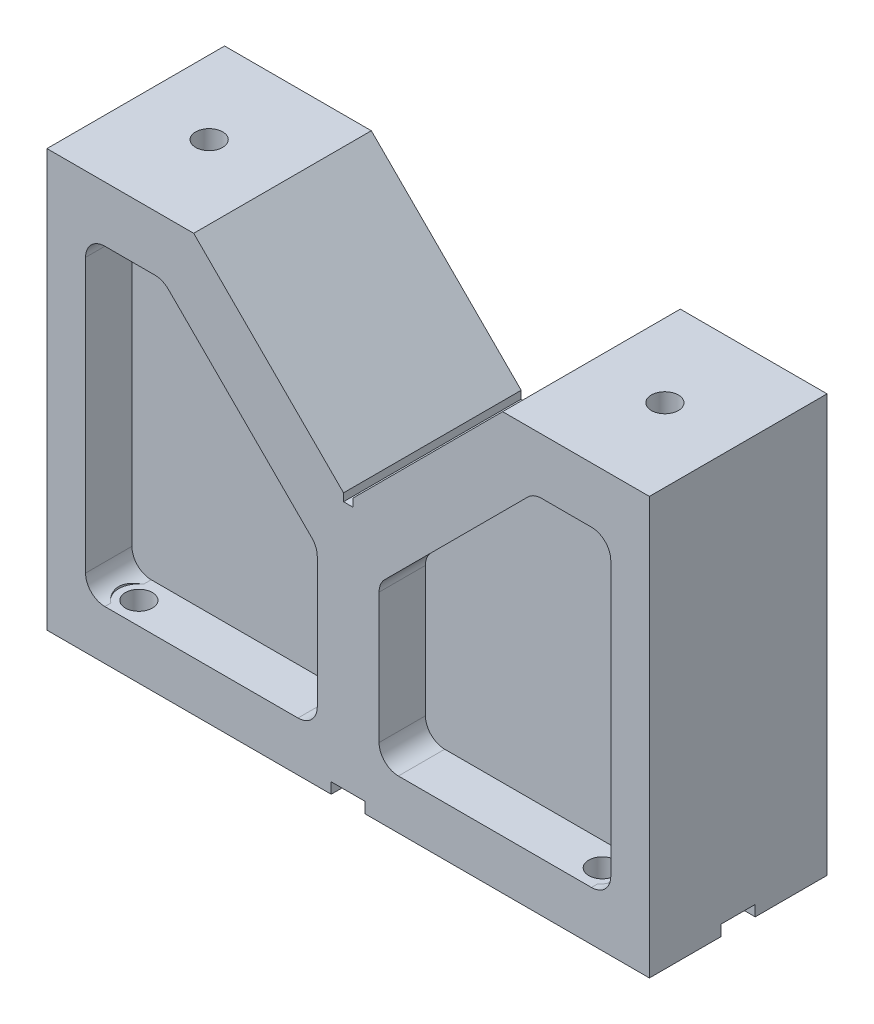
from build123d import *

# Parameters (mm, degrees)
BOSS_EXTRUDE1_DEPTH                            = 57.5
CUT_EXTRUDE1_DEPTH                             = 30
M20_TAPPED_HOLE1_D                             = 17.5
M20_TAPPED_HOLE1_DEPTH                         = 44.5
M20_TAPPED_HOLE1_TIP                           = 5.257530416491153
MIRROR2_COPY_1_DEPTH                           = 30
CUT_EXTRUDE2_DEPTH                             = 7
CUT_EXTRUDE3_DEPTH                             = 7
CBORE_START                                    = -1
CBORE_FOR_M16_HEX_SOCKET_HEAD_CAP_SC_2_R       = 8.75
CBORE_FOR_M16_HEX_SOCKET_HEAD_CAP_SCREW1_DEPTH = 34.275018433
CBORE_START_2                                  = 32
CBORE_FOR_M16_HEX_SOCKET_HEAD_CAP_SC_3_O_R     = 8.75
CBORE_FOR_M16_HEX_SOCKET_HEAD_CAP_SC_3_DEPTH   = 12.5


with BuildPart() as part:
    # Sketch1 → Boss-Extrude1 (new, symmetric)
    with BuildSketch(Plane.XY):
        Polygon((-195, 0), (195, 0), (195.00000000000003, 270), (99.9999999999997, 270.00000000000006), (2.999999999999999, 173.00000000000009), (2.999999999999999, 168.0000000000001), (-2.999999999999999, 168.0000000000001), (-2.999999999999999, 173.00000000000009), (-99.9999999999997, 270.00000000000006), (-195.00000000000003, 270), align=None)
    extrude(amount=BOSS_EXTRUDE1_DEPTH, both=True)

    # Sketch2 → Cut-Extrude1 (cut)
    with BuildSketch(Plane.XY.offset(57.5)):
        with BuildLine():
            Line((32.500000000000014, 32), (157.5, 32))
            ThreePointArc((157.5, 32), (166.33883476483186, 35.661165235168156), (170, 44.5))
            Line((170, 44.5), (170, 221.49999999999997))
            ThreePointArc((170, 221.49999999999997), (166.33883476483186, 230.3388347648318), (157.5, 234))
            Line((157.5, 234), (125.17766952966375, 233.99999999999997))
            ThreePointArc((125.17766952966375, 233.99999999999997), (120.39412662510011, 233.04849415639106), (116.3388347648319, 230.3388347648318))
            Line((116.3388347648319, 230.3388347648318), (23.661165235168177, 137.66116523516763))
            ThreePointArc((23.661165235168177, 137.66116523516763), (20.95150584360897, 133.60587337489943), (20.000000000000004, 128.82233047033586))
            Line((20.000000000000004, 128.82233047033586), (20.000000000000014, 44.5))
            ThreePointArc((20.000000000000014, 44.5), (23.66116523516817, 35.661165235168156), (32.500000000000014, 32))
        make_face()
    cut_extrude1 = extrude(amount=-CUT_EXTRUDE1_DEPTH, mode=Mode.SUBTRACT)

    # M20 Tapped Hole1
    with Locations(Plane(origin=(-1.5777e-13, 270.0000000000001, 0), x_dir=(1, 0, 0), z_dir=(0, 1, 0))):
        with Locations((-147.5, 0), (147.5, 0)):
            Hole(M20_TAPPED_HOLE1_D / 2, depth=M20_TAPPED_HOLE1_DEPTH)
            with Locations((0, 0, -(M20_TAPPED_HOLE1_DEPTH + M20_TAPPED_HOLE1_TIP / 2))):  # 118° drill point
                Cone(0, M20_TAPPED_HOLE1_D / 2, M20_TAPPED_HOLE1_TIP, mode=Mode.SUBTRACT)

    # Mirror1: Cut-Extrude1 across plane
    add(cut_extrude1.mirror(Plane(origin=(0, 0, 0), x_dir=(0, 0, 1), z_dir=(1, 0, 0))), mode=Mode.SUBTRACT)

    # Mirror2: Cut-Extrude1 across plane
    add(cut_extrude1.mirror(Plane.XY), mode=Mode.SUBTRACT)

    # Mirror2 copy 1 sketch → Mirror2 copy 1 (cut)
    with BuildSketch(Plane(origin=(0, 0, -57.5), x_dir=(-1, 0, 0), z_dir=(0, 0, -1))):
        with BuildLine():
            Line((32.500000000000014, 32), (157.5, 32))
            ThreePointArc((157.5, 32), (166.33883476483186, 35.661165235168156), (170, 44.5))
            Line((170, 44.5), (170, 221.49999999999997))
            ThreePointArc((170, 221.49999999999997), (166.33883476483186, 230.3388347648318), (157.5, 234))
            Line((157.5, 234), (125.17766952966375, 233.99999999999997))
            ThreePointArc((125.17766952966375, 233.99999999999997), (120.39412662510011, 233.04849415639106), (116.3388347648319, 230.3388347648318))
            Line((116.3388347648319, 230.3388347648318), (23.661165235168177, 137.66116523516763))
            ThreePointArc((23.661165235168177, 137.66116523516763), (20.95150584360897, 133.60587337489943), (20.000000000000004, 128.82233047033586))
            Line((20.000000000000004, 128.82233047033586), (20.000000000000014, 44.5))
            ThreePointArc((20.000000000000014, 44.5), (23.66116523516817, 35.661165235168156), (32.500000000000014, 32))
        make_face()
    extrude(amount=-MIRROR2_COPY_1_DEPTH, mode=Mode.SUBTRACT)

    # Sketch5 → Cut-Extrude2 (cut)
    with BuildSketch(Plane.XZ):
        Polygon((-11.00000000000001, -57.5), (11.00000000000001, -57.5), (11, 57.5), (-11, 57.5), align=None)
    extrude(amount=-CUT_EXTRUDE2_DEPTH, mode=Mode.SUBTRACT)

    # Sketch6 → Cut-Extrude3 (cut)
    with BuildSketch(Plane.XZ):
        Polygon((-195, -11.000000000000004), (195, -11), (195, 11), (-195, 11.000000000000004), align=None)
    extrude(amount=-CUT_EXTRUDE3_DEPTH, mode=Mode.SUBTRACT)

    # CBORE for M16 Hex Socket Head Cap Screw1: read off the stored shape, not the designer's step
    # CBORE for M16 Hex Socket Head Cap Sc 2 → CBORE for M16 Hex Socket Head Cap Screw1 (cut)
    with BuildSketch(Plane(origin=(0, 0, 0), x_dir=(1, 0, 0), z_dir=(0, 1, 0)).offset(CBORE_START)):
        with Locations((-150, -43)):
            Circle(CBORE_FOR_M16_HEX_SOCKET_HEAD_CAP_SC_2_R)
    extrude(amount=CBORE_FOR_M16_HEX_SOCKET_HEAD_CAP_SCREW1_DEPTH, mode=Mode.SUBTRACT)

    # CBORE for M16 Hex Socket Head Cap Sc 3 o → CBORE for M16 Hex Socket Head Cap Sc 3 (cut)
    with BuildSketch(Plane(origin=(0, 0, 0), x_dir=(1, 0, 0), z_dir=(0, 1, 0)).offset(CBORE_START_2)):
        with BuildLine():
            Line((-155.543924868, -31), (-157.5, -32.381619709))
            ThreePointArc((-157.5, -32.381619709), (-163, -43), (-157.5, -53.618380291))
            Line((-157.5, -53.618380291), (-155.543924868, -55))
            Line((-155.543924868, -55), (-140, -55))
            Line((-140, -55), (-140, -31))
            Line((-140, -31), (-155.543924868, -31))
        make_face()
        with Locations((-150, -43)):
            Circle(CBORE_FOR_M16_HEX_SOCKET_HEAD_CAP_SC_3_O_R, mode=Mode.SUBTRACT)
    extrude(amount=CBORE_FOR_M16_HEX_SOCKET_HEAD_CAP_SC_3_DEPTH, mode=Mode.SUBTRACT)

    # LPattern1: read off the stored shape, not the designer's step
    # LPattern1: loft between two sections, ruled curve by curve
    lpattern1_from = [
        Edge.make_three_point_arc((-157.5, 31.999999688, -53.618380291), (-163, 31.999999688, -43), (-157.5, 31.999999688, -32.381619709)),
        Edge.make_line((-157.5, 31.999999688, -32.381619709), (-157.5, 31.999999688, -53.618380291)),
    ]
    lpattern1_to = [
        Edge.make_three_point_arc((-157.5, 33.2753422, -53.618380291), (-163, 33.2753422, -43), (-157.5, 33.2753422, -32.381619709)),
        Edge.make_line((-157.5, 33.2753422, -32.381619709), (-157.5, 33.2753422, -53.618380291)),
    ]
    lpattern1 = Solid(Shell([*[Face.make_surface_from_curves(lpattern1_from[k], lpattern1_to[k]) for k in range(2)], Face(Wire(lpattern1_from)), Face(Wire(lpattern1_to))]))
    add(lpattern1, mode=Mode.SUBTRACT)

    # LPattern1 2: loft between two sections, ruled curve by curve
    lpattern1_2_from = [
        Edge.make_three_point_arc((-150, 0, -34.25), (-141.25, 0, -43), (-150, 0, -51.75)),
        Edge.make_three_point_arc((-150, 0, -51.75), (-158.75, 0, -43), (-150, 0, -34.25)),
    ]
    lpattern1_2_to = [
        Edge.make_three_point_arc((-150, 32, -34.25), (-141.25, 32, -43), (-150, 32, -51.75)),
        Edge.make_three_point_arc((-150, 32, -51.75), (-158.75, 32, -43), (-150, 32, -34.25)),
    ]
    lpattern1_2 = Solid(Shell([*[Face.make_surface_from_curves(lpattern1_2_from[k], lpattern1_2_to[k]) for k in range(2)], Face(Wire(lpattern1_2_from)), Face(Wire(lpattern1_2_to))]))
    add(lpattern1_2, mode=Mode.SUBTRACT)

    # LPattern1 3: loft between two sections, ruled curve by curve
    lpattern1_3_from = [
        Edge.make_three_point_arc((157.5, 31.999999688, 53.618380291), (163, 31.999999688, 43), (157.5, 31.999999688, 32.381619709)),
        Edge.make_line((157.5, 31.999999688, 32.381619709), (157.5, 31.999999688, 53.618380291)),
    ]
    lpattern1_3_to = [
        Edge.make_three_point_arc((157.5, 33.2753422, 53.618380291), (163, 33.2753422, 43), (157.5, 33.2753422, 32.381619709)),
        Edge.make_line((157.5, 33.2753422, 32.381619709), (157.5, 33.2753422, 53.618380291)),
    ]
    lpattern1_3 = Solid(Shell([*[Face.make_surface_from_curves(lpattern1_3_from[k], lpattern1_3_to[k]) for k in range(2)], Face(Wire(lpattern1_3_from)), Face(Wire(lpattern1_3_to))]))
    add(lpattern1_3, mode=Mode.SUBTRACT)

    # LPattern1 4: loft between two sections, ruled curve by curve
    lpattern1_4_from = [
        Edge.make_three_point_arc((150, 0, 51.75), (158.75, 0, 43), (150, 0, 34.25)),
        Edge.make_three_point_arc((150, 0, 34.25), (141.25, 0, 43), (150, 0, 51.75)),
    ]
    lpattern1_4_to = [
        Edge.make_three_point_arc((150, 32, 51.75), (158.75, 32, 43), (150, 32, 34.25)),
        Edge.make_three_point_arc((150, 32, 34.25), (141.25, 32, 43), (150, 32, 51.75)),
    ]
    lpattern1_4 = Solid(Shell([*[Face.make_surface_from_curves(lpattern1_4_from[k], lpattern1_4_to[k]) for k in range(2)], Face(Wire(lpattern1_4_from)), Face(Wire(lpattern1_4_to))]))
    add(lpattern1_4, mode=Mode.SUBTRACT)

    # LPattern1 5: loft between two sections, ruled curve by curve
    lpattern1_5_from = [
        Edge.make_three_point_arc((150, 0, -34.25), (158.75, 0, -43), (150, 0, -51.75)),
        Edge.make_three_point_arc((150, 0, -51.75), (141.25, 0, -43), (150, 0, -34.25)),
    ]
    lpattern1_5_to = [
        Edge.make_three_point_arc((150, 32, -34.25), (158.75, 32, -43), (150, 32, -51.75)),
        Edge.make_three_point_arc((150, 32, -51.75), (141.25, 32, -43), (150, 32, -34.25)),
    ]
    lpattern1_5 = Solid(Shell([*[Face.make_surface_from_curves(lpattern1_5_from[k], lpattern1_5_to[k]) for k in range(2)], Face(Wire(lpattern1_5_from)), Face(Wire(lpattern1_5_to))]))
    add(lpattern1_5, mode=Mode.SUBTRACT)

    # LPattern1 6: loft between two sections, ruled curve by curve
    lpattern1_6_from = [
        Edge.make_three_point_arc((157.5, 31.999999688, -32.381619709), (163, 31.999999688, -43), (157.5, 31.999999688, -53.618380291)),
        Edge.make_line((157.5, 31.999999688, -53.618380291), (157.5, 31.999999688, -32.381619709)),
    ]
    lpattern1_6_to = [
        Edge.make_three_point_arc((157.5, 33.2753422, -32.381619709), (163, 33.2753422, -43), (157.5, 33.2753422, -53.618380291)),
        Edge.make_line((157.5, 33.2753422, -53.618380291), (157.5, 33.2753422, -32.381619709)),
    ]
    lpattern1_6 = Solid(Shell([*[Face.make_surface_from_curves(lpattern1_6_from[k], lpattern1_6_to[k]) for k in range(2)], Face(Wire(lpattern1_6_from)), Face(Wire(lpattern1_6_to))]))
    add(lpattern1_6, mode=Mode.SUBTRACT)


solid = part.part
